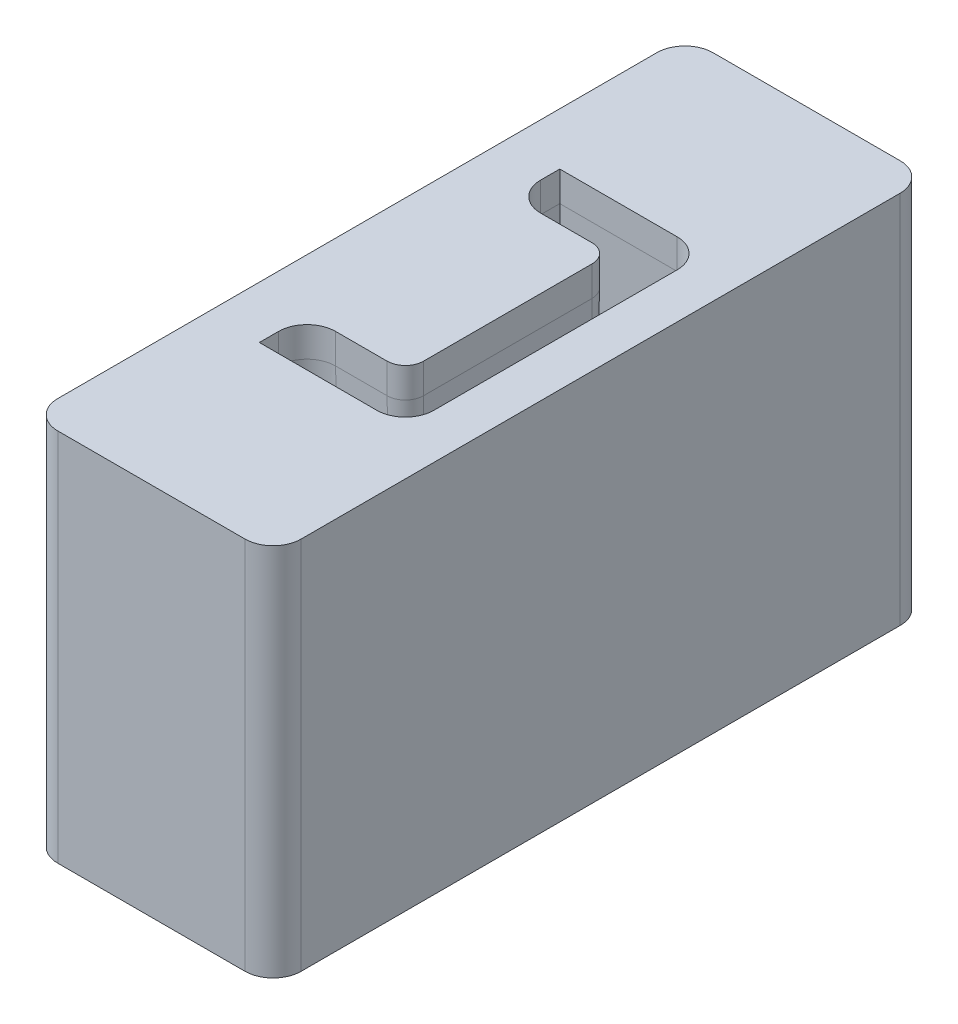
from build123d import *

# Parameters (mm, degrees)
SKETCH1_W             = 26
SKETCH1_H             = 70
BOSS_EXTRUDE1_DEPTH   = 40
FILLET1_R             = 3
CUT_EXTRUDE1_REACH    = 56.717
M8_TAPPED_HOLE1_D     = 6.8
M8_TAPPED_HOLE1_DEPTH = 22.25
M8_TAPPED_HOLE1_TIP   = 2.042926105


with BuildPart() as part:
    # Sketch1 → Boss-Extrude1 (new body)
    with BuildSketch(Plane(origin=(0, 0, 0), x_dir=(1, 0, 0), z_dir=(0, 1, 0))):
        Rectangle(SKETCH1_W, SKETCH1_H)
    extrude(amount=-BOSS_EXTRUDE1_DEPTH)

    # Fillet1
    fillet1_edges = [part.edges().sort_by_distance(p)[0] for p in [
        (-13, -20, -35),
        (13, -20, -35),
        (-13, -20, 35),
        (13, -20, 35),
    ]]
    fillet(fillet1_edges, radius=FILLET1_R)

    # Sketch9 → Cut-Extrude1 (cut, up to next)
    with BuildSketch(Plane(origin=(0, 0, 0), x_dir=(1, 0, 0), z_dir=(0, 1, 0)), mode=Mode.PRIVATE) as cut_extrude1_sk1:
        with BuildLine():
            Line((3.08, 9), (3.08, -9))
            ThreePointArc((3.08, -9), (2.508858223, -10.378858223), (1.13, -10.95))
            Line((1.13, -10.95), (-4.37, -10.95))
            ThreePointArc((-4.37, -10.95), (-6.526675683, -11.843324317), (-7.42, -14))
            Line((-7.42, -14), (-7.42, -16.05))
            Line((-7.42, -16.05), (5.13, -16.05))
            ThreePointArc((5.13, -16.05), (7.286675683, -15.156675683), (8.18, -13))
            Line((8.18, -13), (8.18, 13))
            ThreePointArc((8.18, 13), (7.286675683, 15.156675683), (5.13, 16.05))
            Line((5.13, 16.05), (-7.42, 16.05))
            Line((-7.42, 16.05), (-7.42, 14))
            ThreePointArc((-7.42, 14), (-6.526675683, 11.843324317), (-4.37, 10.95))
            Line((-4.37, 10.95), (1.13, 10.95))
            ThreePointArc((1.13, 10.95), (2.508858223, 10.378858223), (3.08, 9))
        make_face()
    cut_extrude1_tool1 = extrude(cut_extrude1_sk1.sketch, amount=-CUT_EXTRUDE1_REACH, mode=Mode.PRIVATE) & part.part
    add(cut_extrude1_tool1.solids().sort_by_distance((3.436899, 0, 0))[0], mode=Mode.SUBTRACT)

    # Cut-Sweep1: sweep along a path in Sketch12
    with BuildLine(Plane(origin=(0, 0, 0), x_dir=(1, 0, 0), z_dir=(0, 1, 0))) as cut_sweep1_path:
        Line((-7.42, -14), (-7.42, -16.05))
        Line((-7.42, -16.05), (5.13, -16.05))
        ThreePointArc((5.13, -16.05), (7.286675683, -15.156675683), (8.18, -13))
        Line((8.18, -13), (8.18, 13))
        ThreePointArc((8.18, 13), (7.286675683, 15.156675683), (5.13, 16.05))
        Line((5.13, 16.05), (-7.42, 16.05))
        Line((-7.42, 16.05), (-7.42, 14))
        ThreePointArc((-7.42, 14), (-6.526675683, 11.843324317), (-4.37, 10.95))
        Line((-4.37, 10.95), (1.13, 10.95))
        ThreePointArc((1.13, 10.95), (2.508858223, 10.378858223), (3.08, 9))
        Line((3.08, 9), (3.08, -9))
        ThreePointArc((3.08, -9), (2.508858223, -10.378858223), (1.13, -10.95))
        Line((1.13, -10.95), (-4.37, -10.95))
        ThreePointArc((-4.37, -10.95), (-6.526675683, -11.843324317), (-7.42, -14))
    # Sketch11 → Cut-Sweep1 (sweep, cut)
    with BuildSketch(Plane.XY):
        Polygon((8.18, -3.2), (8.822346389, -40), (8.18, -40), align=None)
    sweep(path=cut_sweep1_path.line, transition=Transition.RIGHT, mode=Mode.SUBTRACT)

    # M8 Tapped Hole1
    with Locations(Plane(origin=(0, -40, 0), x_dir=(-1, 0, 0), z_dir=(0, -1, 0))):
        with Locations((0, -25.846173195), (0, 25.846173195)):
            Hole(M8_TAPPED_HOLE1_D / 2, depth=M8_TAPPED_HOLE1_DEPTH)
            with Locations((0, 0, -(M8_TAPPED_HOLE1_DEPTH + M8_TAPPED_HOLE1_TIP / 2))):  # 118° drill point
                Cone(0, M8_TAPPED_HOLE1_D / 2, M8_TAPPED_HOLE1_TIP, mode=Mode.SUBTRACT)


solid = part.part
